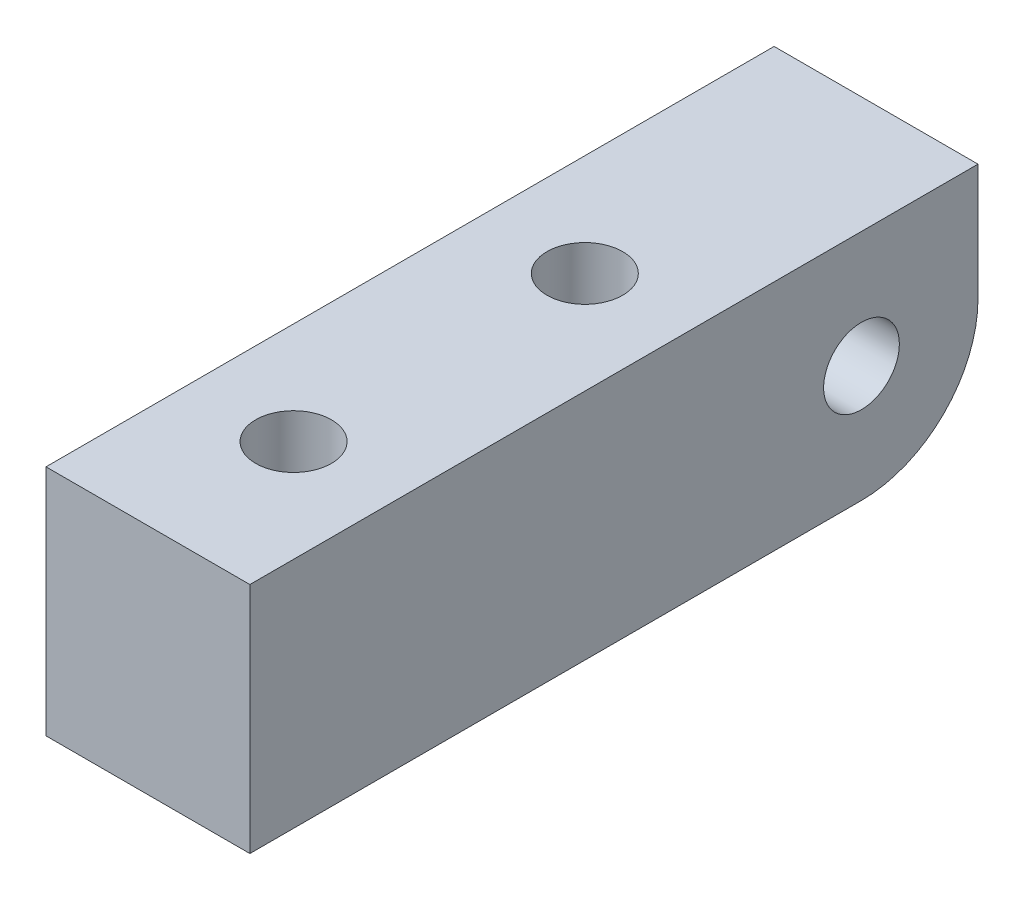
from build123d import *

# Parameters (mm, degrees)
SKETCH1_W           = 25
SKETCH1_H           = 8
SKETCH1_R           = 1.3
BOSS_EXTRUDE1_DEPTH = 3.5
FILLET1_R           = 4
SKETCH3_R           = 1.3
CUT_EXTRUDE6_DEPTH  = 23.743130831
SKETCH5_R           = 2.5
CUT_EXTRUDE7_DEPTH  = 3


with BuildPart() as part:
    # Sketch1 → Boss-Extrude1 (new, symmetric)
    with BuildSketch(Plane(origin=(0, 0, 0), x_dir=(0, 0, -1), z_dir=(1, 0, 0))):
        with Locations((-8.5, 0)):
            Rectangle(SKETCH1_W, SKETCH1_H)
        Circle(SKETCH1_R, mode=Mode.SUBTRACT)
    extrude(amount=BOSS_EXTRUDE1_DEPTH, both=True)

    # Fillet1
    fillet1_edges = [part.edges().sort_by_distance(p)[0] for p in [
        (0, -4, -4),
    ]]
    fillet(fillet1_edges, radius=FILLET1_R)

    # Sketch3 → Cut-Extrude6 (cut, through all)
    with BuildSketch(Plane(origin=(0, 4, 0), x_dir=(1, 0, 0), z_dir=(0, 1, 0))):
        with Locations((0, -6)):
            Circle(SKETCH3_R)
        with Locations((0, -16)):
            Circle(SKETCH3_R)
    extrude(amount=-CUT_EXTRUDE6_DEPTH, mode=Mode.SUBTRACT)

    # Sketch5 → Cut-Extrude7 (cut)
    with BuildSketch(Plane.XZ.offset(4)):
        with Locations((0, 16)):
            Circle(SKETCH5_R)
        with Locations((0, 6)):
            Circle(SKETCH5_R)
    extrude(amount=-CUT_EXTRUDE7_DEPTH, mode=Mode.SUBTRACT)


solid = part.part
